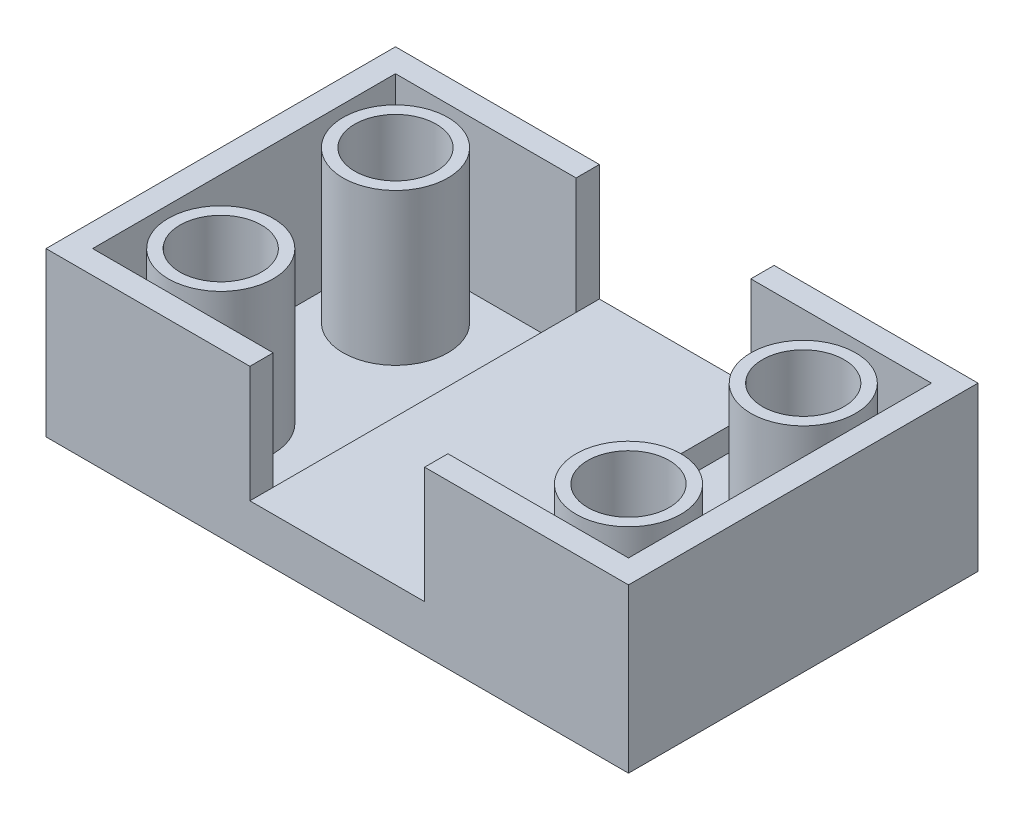
from build123d import *
from OCP.BRepFilletAPI import BRepFilletAPI_MakeChamfer

# Parameters (mm, degrees)
SKETCH1_W           = 50
SKETCH1_H           = 30
SKETCH1_R           = 2.5
BOSS_EXTRUDE1_DEPTH = 15
SKETCH2_W           = 15
SKETCH2_H           = 30
CUT_EXTRUDE1_DEPTH  = 10
CHAMFER1_SIZE       = 0.75
CHAMFER1_SIZE2      = 1.299038106
SHELL1_START        = 2
SHELL1_OUTLINE_W    = 15.5
SHELL1_OUTLINE_H    = 26
SHELL1_OUTLINE_R    = 4.5
SHELL1_DEPTH        = 13
SHELL1_2_OUTLINE_W  = 15
SHELL1_2_OUTLINE_H  = 26
SHELL1_2_DEPTH      = 1
SKETCH3_R           = 3.5
CUT_EXTRUDE2_DEPTH  = 5
SKETCH4_R           = 3.5
CUT_EXTRUDE3_DEPTH  = 5
SKETCH5_R           = 3.5
CUT_EXTRUDE4_DEPTH  = 5
SKETCH6_R           = 3.5
CUT_EXTRUDE5_DEPTH  = 5
CHAMFER2_SIZE       = 1


# Read off the part's stored shape, not the designer's step: Shell1
with BuildPart() as part:
    # Sketch1 → Boss-Extrude1 (new body)
    with BuildSketch(Plane(origin=(0, 0, 0), x_dir=(1, 0, 0), z_dir=(0, 1, 0))):
        Rectangle(SKETCH1_W, SKETCH1_H)
        with Locations(Location((-17.5, 7.5, 0), (0, 0, 270))):
            Circle(SKETCH1_R, mode=Mode.SUBTRACT)
        with Locations(Location((17.5, 7.5, 0), (0, 0, 90))):
            Circle(SKETCH1_R, mode=Mode.SUBTRACT)
        with Locations(Location((17.5, -7.5, 0), (0, 0, 270))):
            Circle(SKETCH1_R, mode=Mode.SUBTRACT)
        with Locations(Location((-17.5, -7.5, 0), (0, 0, 90))):
            Circle(SKETCH1_R, mode=Mode.SUBTRACT)
    extrude(amount=BOSS_EXTRUDE1_DEPTH)

    # Sketch2 → Cut-Extrude1 (cut)
    with BuildSketch(Plane(origin=(0, 15, 0), x_dir=(1, 0, 0), z_dir=(0, 1, 0))):
        Rectangle(SKETCH2_W, SKETCH2_H)
    extrude(amount=-CUT_EXTRUDE1_DEPTH, mode=Mode.SUBTRACT)

    # Chamfer1: one chamfer whose edges measure the first distance from different faces: ONE call of the kernel's chamfer builder (chamfer() names one face for all edges)
    chamfer1_edges_1 = [part.edges().sort_by_distance(p)[0] for p in [
        (-17.5, 0, -10),
    ]]
    chamfer1_side_1 = [part.faces().sort_by_distance(p)[0] for p in [
        (-17.5, 7.5, -10),
    ]]
    chamfer1_edges_2 = [part.edges().sort_by_distance(p)[0] for p in [
        (17.5, 0, -5),
    ]]
    chamfer1_side_2 = [part.faces().sort_by_distance(p)[0] for p in [
        (17.5, 7.5, -5),
    ]]
    chamfer1_edges_3 = [part.edges().sort_by_distance(p)[0] for p in [
        (17.5, 0, 5),
    ]]
    chamfer1_side_3 = [part.faces().sort_by_distance(p)[0] for p in [
        (17.5, 7.5, 5),
    ]]
    chamfer1_edges_4 = [part.edges().sort_by_distance(p)[0] for p in [
        (-17.5, 0, 10),
    ]]
    chamfer1_side_4 = [part.faces().sort_by_distance(p)[0] for p in [
        (-17.5, 7.5, 10),
    ]]
    chamfer1 = BRepFilletAPI_MakeChamfer(part.part.solid().wrapped)
    for e in chamfer1_edges_1:
        chamfer1.Add(CHAMFER1_SIZE, CHAMFER1_SIZE2, e.wrapped, chamfer1_side_1[0].wrapped)  # the first distance lies on this face
    for e in chamfer1_edges_2:
        chamfer1.Add(CHAMFER1_SIZE, CHAMFER1_SIZE2, e.wrapped, chamfer1_side_2[0].wrapped)  # the first distance lies on this face
    for e in chamfer1_edges_3:
        chamfer1.Add(CHAMFER1_SIZE, CHAMFER1_SIZE2, e.wrapped, chamfer1_side_3[0].wrapped)  # the first distance lies on this face
    for e in chamfer1_edges_4:
        chamfer1.Add(CHAMFER1_SIZE, CHAMFER1_SIZE2, e.wrapped, chamfer1_side_4[0].wrapped)  # the first distance lies on this face
    add(Compound.cast(chamfer1.Shape()), mode=Mode.REPLACE)

    # Shell1 outline → Shell1 (cut)
    # profile 1 of 2: a face of its own
    with BuildSketch(Plane(origin=(0, 0, 0), x_dir=(1, 0, 0), z_dir=(0, 1, 0)).offset(SHELL1_START)):
        with Locations((-15.25, 0)):
            Rectangle(SHELL1_OUTLINE_W, SHELL1_OUTLINE_H)
        with Locations((-17.5, -7.5)):
            Circle(SHELL1_OUTLINE_R, mode=Mode.SUBTRACT)
        with Locations((-17.5, 7.5)):
            Circle(SHELL1_OUTLINE_R, mode=Mode.SUBTRACT)
    # profile 2 of 2: a face of its own
    with BuildSketch(Plane(origin=(0, 0, 0), x_dir=(1, 0, 0), z_dir=(0, 1, 0)).offset(SHELL1_START)):
        with Locations((15.25, 0)):
            Rectangle(SHELL1_OUTLINE_W, SHELL1_OUTLINE_H)
        with Locations((17.5, -7.5)):
            Circle(SHELL1_OUTLINE_R, mode=Mode.SUBTRACT)
        with Locations((17.5, 7.5)):
            Circle(SHELL1_OUTLINE_R, mode=Mode.SUBTRACT)
    extrude(amount=SHELL1_DEPTH, mode=Mode.SUBTRACT)

    # Shell1 2 outline → Shell1 2 (cut)
    with BuildSketch(Plane(origin=(0, 0, 0), x_dir=(1, 0, 0), z_dir=(0, 1, 0)).offset(SHELL1_START)):
        Rectangle(SHELL1_2_OUTLINE_W, SHELL1_2_OUTLINE_H)
    extrude(amount=SHELL1_2_DEPTH, mode=Mode.SUBTRACT)

    # Sketch3 → Cut-Extrude2 (cut)
    with BuildSketch(Plane(origin=(0, 15, 0), x_dir=(1, 0, 0), z_dir=(0, 1, 0))):
        with Locations(Location((-17.5, -7.5, 0), (0, 0, 270))):
            Circle(SKETCH3_R)
    extrude(amount=-CUT_EXTRUDE2_DEPTH, mode=Mode.SUBTRACT)

    # Sketch4 → Cut-Extrude3 (cut)
    with BuildSketch(Plane(origin=(0, 15, 0), x_dir=(1, 0, 0), z_dir=(0, 1, 0))):
        with Locations(Location((-17.5, 7.5, 0), (0, 0, 270))):
            Circle(SKETCH4_R)
    extrude(amount=-CUT_EXTRUDE3_DEPTH, mode=Mode.SUBTRACT)

    # Sketch5 → Cut-Extrude4 (cut)
    with BuildSketch(Plane(origin=(0, 15, 0), x_dir=(1, 0, 0), z_dir=(0, 1, 0))):
        with Locations(Location((17.5, 7.5, 0), (0, 0, 270))):
            Circle(SKETCH5_R)
    extrude(amount=-CUT_EXTRUDE4_DEPTH, mode=Mode.SUBTRACT)

    # Sketch6 → Cut-Extrude5 (cut)
    with BuildSketch(Plane(origin=(0, 15, 0), x_dir=(1, 0, 0), z_dir=(0, 1, 0))):
        with Locations(Location((17.5, -7.5, 0), (0, 0, 270))):
            Circle(SKETCH6_R)
    extrude(amount=-CUT_EXTRUDE5_DEPTH, mode=Mode.SUBTRACT)

    # Chamfer2
    chamfer2_edges = [part.edges().sort_by_distance(p)[0] for p in [
        (0, 0, -15),
        (25, 0, 0),
        (0, 0, 15),
        (-25, 0, 0),
    ]]
    chamfer(chamfer2_edges, length=CHAMFER2_SIZE)


solid = part.part
